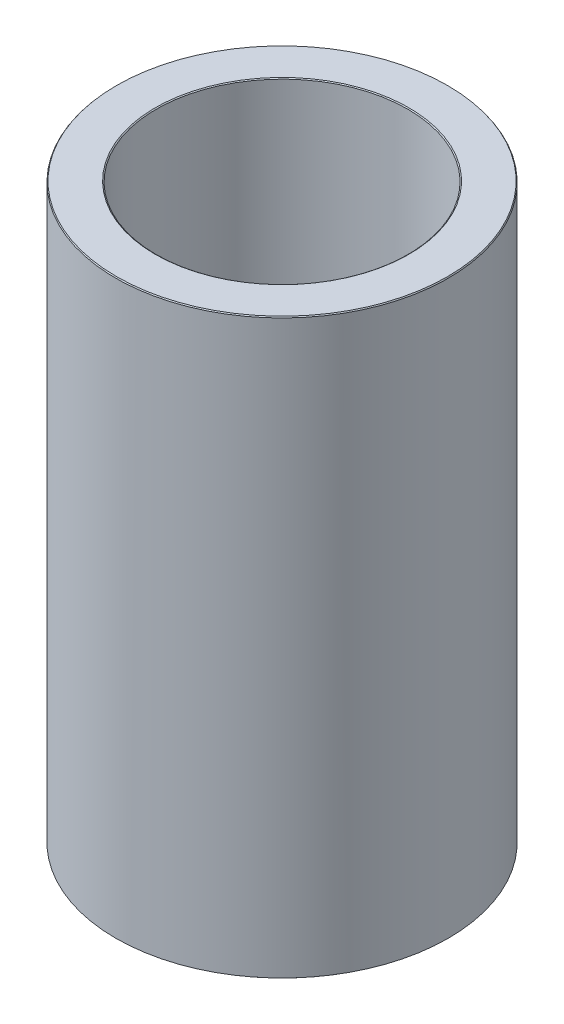
from build123d import *
from OCP.BRepFilletAPI import BRepFilletAPI_MakeChamfer

# Parameters (mm, degrees)
SKETCH1_R           = 57.5
BOSS_EXTRUDE1_DEPTH = 198.304315311
SKETCH2_R           = 43.533972979
CUT_EXTRUDE1_DEPTH  = 215.329422784
CHAMFER1_SIZE       = 0.358203659
CHAMFER1_SIZE2      = 0.254148229


with BuildPart() as part:
    # Sketch1 → Boss-Extrude1 (new body)
    with BuildSketch(Plane(origin=(0, 0, 0), x_dir=(1, 0, 0), z_dir=(0, 1, 0))):
        Circle(SKETCH1_R)
    extrude(amount=BOSS_EXTRUDE1_DEPTH)

    # Sketch2 → Cut-Extrude1 (cut, through all)
    with BuildSketch(Plane(origin=(0, 0, 0), x_dir=(1, 0, 0), z_dir=(0, 1, 0))):
        Circle(SKETCH2_R)
    extrude(amount=CUT_EXTRUDE1_DEPTH, mode=Mode.SUBTRACT)

    # Chamfer1: one chamfer whose edges measure the first distance from different faces: ONE call of the kernel's chamfer builder (chamfer() names one face for all edges)
    chamfer1_edges_1 = [part.edges().sort_by_distance(p)[0] for p in [
        (-43.533972979, 198.304315311, 0),
    ]]
    chamfer1_side_1 = [part.faces().sort_by_distance(p)[0] for p in [
        (-55.873654403, 198.304315311, 0),
    ]]
    chamfer1_edges_2 = [part.edges().sort_by_distance(p)[0] for p in [
        (-43.533972979, 0, 0),
    ]]
    chamfer1_side_2 = [part.faces().sort_by_distance(p)[0] for p in [
        (-43.533972979, 99.152157655, 0),
    ]]
    chamfer1_edges_3 = [part.edges().sort_by_distance(p)[0] for p in [
        (-57.5, 0, 0),
    ]]
    chamfer1_side_3 = [part.faces().sort_by_distance(p)[0] for p in [
        (-55.873654403, 0, 0),
    ]]
    chamfer1_edges_4 = [part.edges().sort_by_distance(p)[0] for p in [
        (-57.5, 198.304315311, 0),
    ]]
    chamfer1_side_4 = [part.faces().sort_by_distance(p)[0] for p in [
        (-57.5, 99.152157655, 0),
    ]]
    chamfer1 = BRepFilletAPI_MakeChamfer(part.part.solid().wrapped)
    for e in chamfer1_edges_1:
        chamfer1.Add(CHAMFER1_SIZE, CHAMFER1_SIZE2, e.wrapped, chamfer1_side_1[0].wrapped)  # the first distance lies on this face
    for e in chamfer1_edges_2:
        chamfer1.Add(CHAMFER1_SIZE, CHAMFER1_SIZE2, e.wrapped, chamfer1_side_2[0].wrapped)  # the first distance lies on this face
    for e in chamfer1_edges_3:
        chamfer1.Add(CHAMFER1_SIZE, CHAMFER1_SIZE2, e.wrapped, chamfer1_side_3[0].wrapped)  # the first distance lies on this face
    for e in chamfer1_edges_4:
        chamfer1.Add(CHAMFER1_SIZE, CHAMFER1_SIZE2, e.wrapped, chamfer1_side_4[0].wrapped)  # the first distance lies on this face
    add(Compound.cast(chamfer1.Shape()), mode=Mode.REPLACE)


solid = part.part
